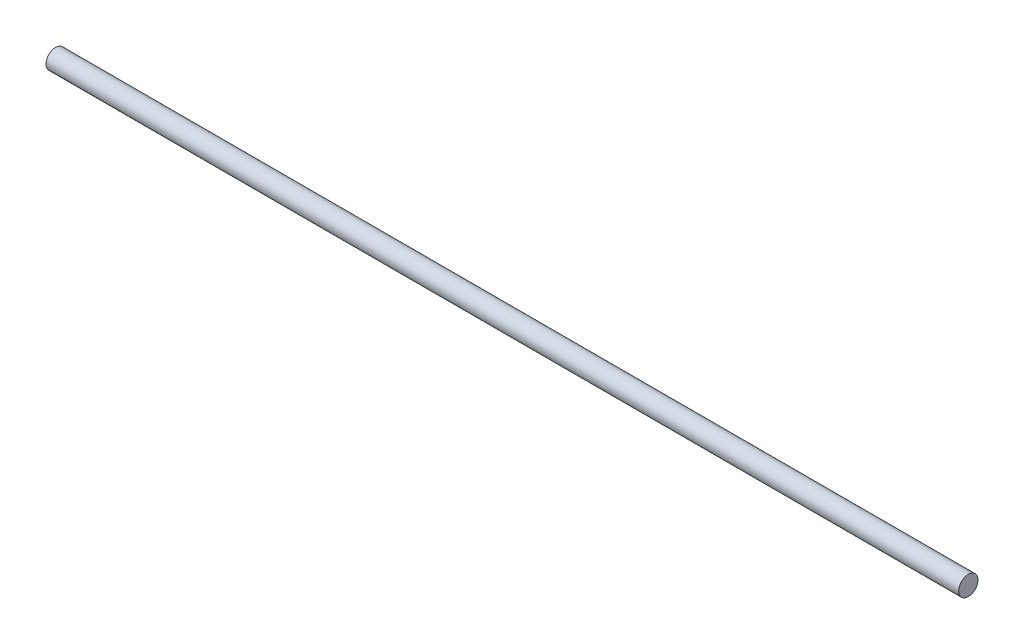
from build123d import *

# Parameters (mm, degrees)
SKETCH1_R           = 4.5
BOSS_EXTRUDE1_DEPTH = 425


with BuildPart() as part:
    # Sketch1 → Boss-Extrude1 (new body)
    with BuildSketch(Plane(origin=(0, 0, 0), x_dir=(0, 0, -1), z_dir=(1, 0, 0))):
        Circle(SKETCH1_R)
    extrude(amount=BOSS_EXTRUDE1_DEPTH)


solid = part.part
